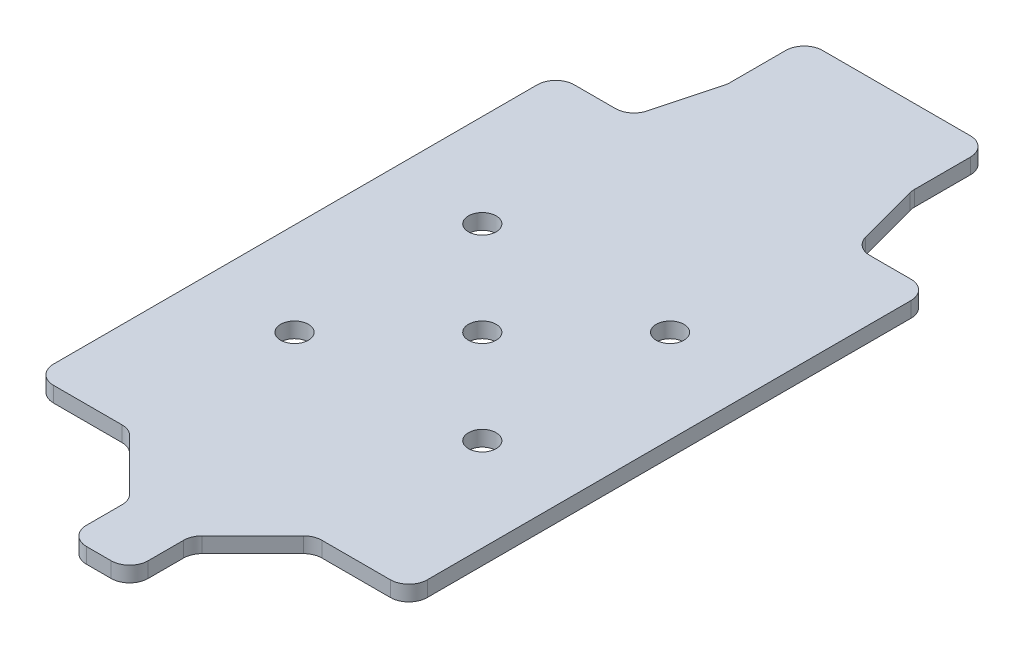
from build123d import *

# Parameters (mm, degrees)
BOSS_EXTRUDE1_DEPTH      = 1.25
M4_CLEARANCE_HOLE1_D     = 4.5
M4_CLEARANCE_HOLE1_DEPTH = 5.2
M4_CLEARANCE_HOLE1_TIP   = 1.351936393
FILLET1_R                = 3


with BuildPart() as part:
    # Sketch1 → Boss-Extrude1 (new, symmetric)
    with BuildSketch(Plane(origin=(0, 0, 0), x_dir=(1, 0, 0), z_dir=(0, 1, 0))):
        Polygon((-18.349364905, 42.281834), (-30.35, 42.281834), (-30.35, -42.281834), (-15, -42.281834), (-5, -52.281834), (-5, -62.281834), (5, -62.281834), (5, -52.281834), (15, -42.281834), (30.35, -42.281834), (30.35, 42.281834), (18.349364905, 42.281834), (15, 54.781834), (15, 67.281834), (-15, 67.281834), (-15, 54.781834), align=None)
    extrude(amount=BOSS_EXTRUDE1_DEPTH, both=True)

    # M4 Clearance Hole1
    with Locations(Plane(origin=(0, 1.25, 0), x_dir=(1, 0, 0), z_dir=(0, 1, 0))):
        with Locations((0, 0), (15.25, 15.25), (-15.25, -15.25), (-15.25, 15.25), (15.25, -15.25)):
            Hole(M4_CLEARANCE_HOLE1_D / 2, depth=M4_CLEARANCE_HOLE1_DEPTH)
            with Locations((0, 0, -(M4_CLEARANCE_HOLE1_DEPTH + M4_CLEARANCE_HOLE1_TIP / 2))):  # 118° drill point
                Cone(0, M4_CLEARANCE_HOLE1_D / 2, M4_CLEARANCE_HOLE1_TIP, mode=Mode.SUBTRACT)

    # Fillet1
    fillet1_edges = [part.edges().sort_by_distance(p)[0] for p in [
        (30.35, 0, -42.281834),
        (30.35, 0, 42.281834),
        (-30.35, 0, 42.281834),
        (-30.35, 0, -42.281834),
        (-15, 0, -67.281834),
        (18.349364905, 0, -42.281834),
        (15, 0, -54.781834),
        (15, 0, -67.281834),
        (-15, 0, -54.781834),
        (-18.349364905, 0, -42.281834),
        (15, 0, 42.281834),
        (5, 0, 52.281834),
        (5, 0, 62.281834),
        (-5, 0, 62.281834),
        (-5, 0, 52.281834),
        (-15, 0, 42.281834),
    ]]
    fillet(fillet1_edges, radius=FILLET1_R)


solid = part.part
